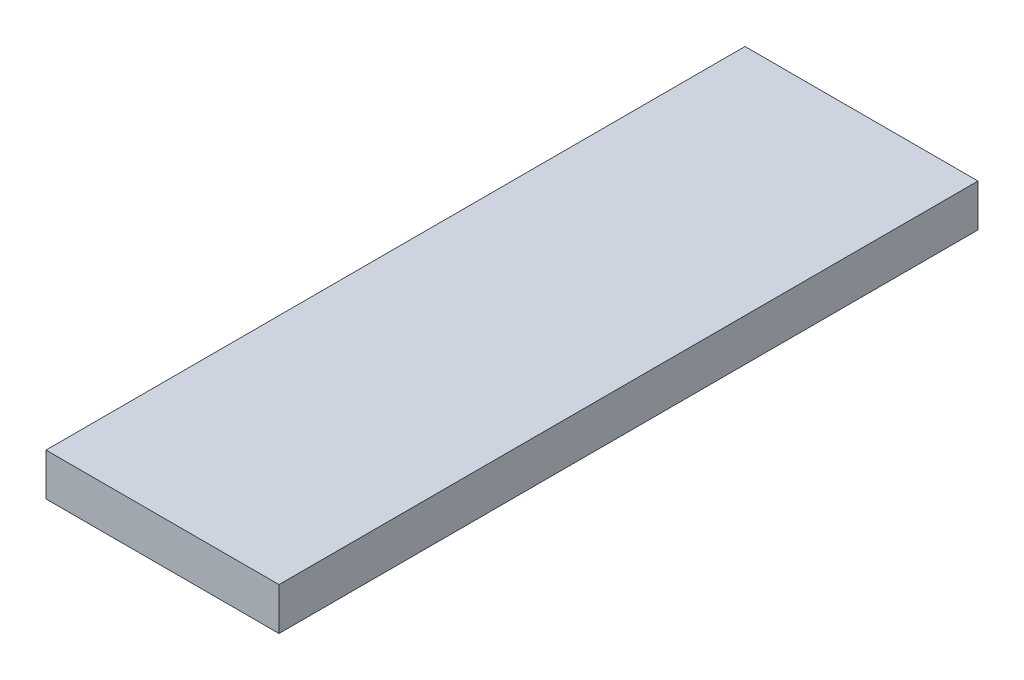
from build123d import *

# Parameters (mm, degrees)
SKETCH1_W           = 55
SKETCH1_H           = 165
BOSS_EXTRUDE1_DEPTH = 10


with BuildPart() as part:
    # Sketch1 → Boss-Extrude1 (new body)
    with BuildSketch(Plane(origin=(0, 0, 0), x_dir=(1, 0, 0), z_dir=(0, 1, 0))):
        with Locations((27.5, 82.5)):
            Rectangle(SKETCH1_W, SKETCH1_H)
    extrude(amount=BOSS_EXTRUDE1_DEPTH)


solid = part.part
